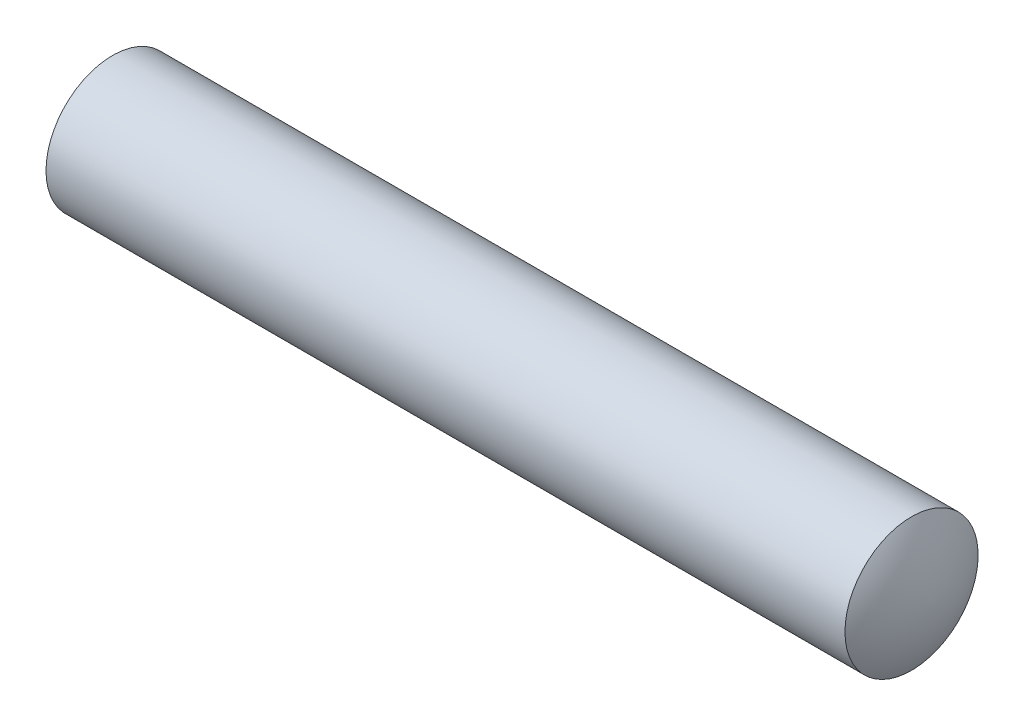
from build123d import *


with BuildPart() as part:
    # Эскиз1 → Повернуть2 (revolve)
    with BuildSketch(Plane.XY):
        with BuildLine():
            Line((0, 2.5), (30, 2.5))
            ThreePointArc((30, 2.5), (30.541006961, 1.299802088), (30.75, 0))
            Line((30.75, 0), (-0.75, 0))
            ThreePointArc((-0.75, 0), (-0.541006961, 1.299802088), (0, 2.5))
        make_face()
    revolve(axis=Axis((0, 0, 0), (1, 0, 0)))


solid = part.part
